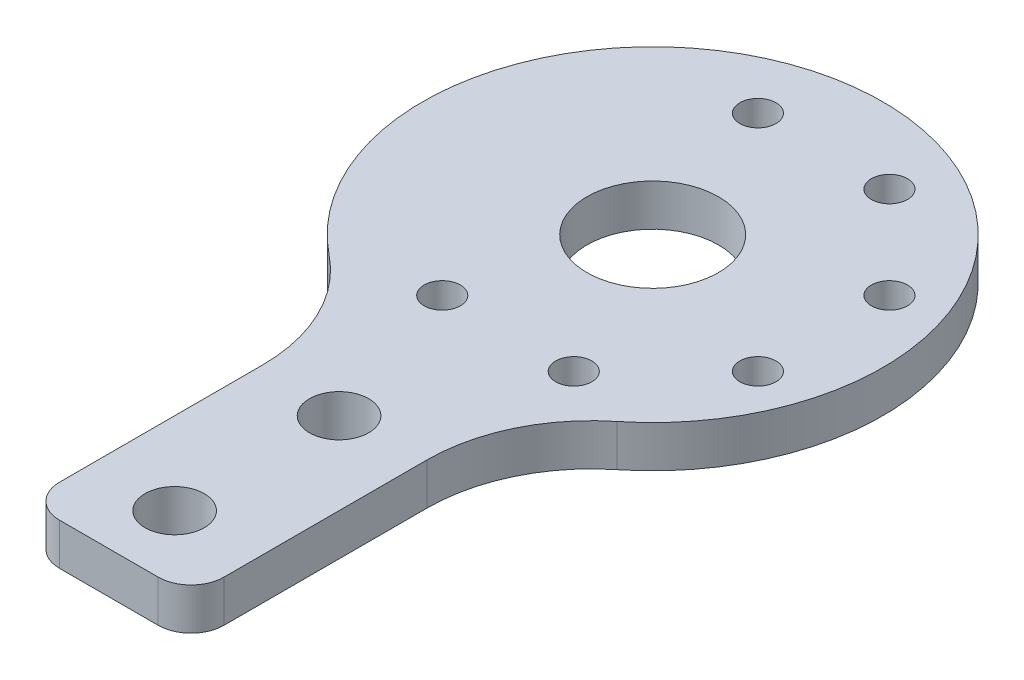
from build123d import *

# Parameters (mm, degrees)
BOSS_EXTRUDE1_DEPTH            = 6.35
SKETCH5_R                      = 10
CUT_EXTRUDE1_DEPTH             = 91.018035458
M8_CLEARANCE_HOLE1_D           = 9
FILLET1_R                      = 25
M5_CLEARANCE_HOLE1_D           = 5.5
M5_CLEARANCE_HOLE1_CSINK_D     = 5.55
M5_CLEARANCE_HOLE1_CSINK_ANGLE = 90
FILLET2_R                      = 5


with BuildPart() as part:
    # Sketch1 → Boss-Extrude1 (new body)
    with BuildSketch(Plane(origin=(0, 0, 0), x_dir=(1, 0, 0), z_dir=(0, 1, 0))):
        with BuildLine():
            Line((-12.5, -82.691742077), (12.5, -82.691742077))
            Line((12.5, -82.691742077), (12.5, -32.691742077))
            ThreePointArc((12.5, -32.691742077), (0, 35), (-12.5, -32.691742077))
            Line((-12.5, -32.691742077), (-12.5, -82.691742077))
        make_face()
    extrude(amount=BOSS_EXTRUDE1_DEPTH)

    # Sketch5 → Cut-Extrude1 (cut, through all)
    with BuildSketch(Plane.XZ):
        Circle(SKETCH5_R)
    extrude(amount=-CUT_EXTRUDE1_DEPTH, mode=Mode.SUBTRACT)

    # M8 Clearance Hole1 (through all)
    with Locations(Plane(origin=(0, 0, 0), x_dir=(-1, 0, 0), z_dir=(0, -1, 0))):
        with Locations((0, -47.691742077), (0, -72.691742077)):
            Hole(M8_CLEARANCE_HOLE1_D / 2)

    # Fillet1
    fillet1_edges = [part.edges().sort_by_distance(p)[0] for p in [
        (-12.5, 3.175, 32.691742077),
        (12.5, 3.175, 32.691742077),
    ]]
    fillet(fillet1_edges, radius=FILLET1_R)

    # M5 Clearance Hole1 (through all)
    with Locations(Plane(origin=(0, 0, 0), x_dir=(-1, 0, 0), z_dir=(0, -1, 0))):
        with Locations((-12, 24), (8, 24), (-26, 10), (-26, -10), (-12, -24), (8, -24)):
            CounterSinkHole(M5_CLEARANCE_HOLE1_D / 2, M5_CLEARANCE_HOLE1_CSINK_D / 2, counter_sink_angle=M5_CLEARANCE_HOLE1_CSINK_ANGLE)

    # Fillet2
    fillet2_edges = [part.edges().sort_by_distance(p)[0] for p in [
        (-12.5, 3.175, 82.691742077),
        (12.5, 3.175, 82.691742077),
    ]]
    fillet(fillet2_edges, radius=FILLET2_R)


solid = part.part
